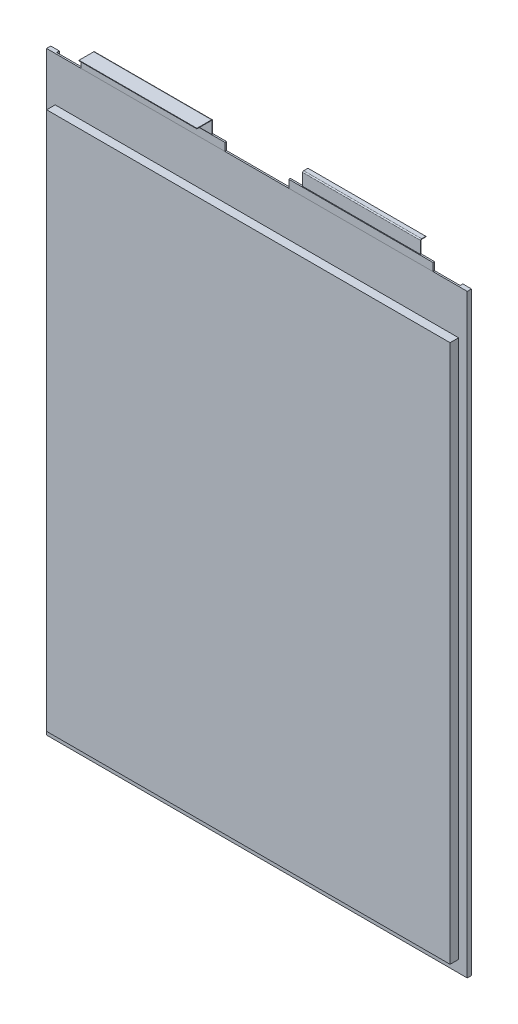
from build123d import *

# Parameters (mm, degrees)
INSULATION_DEPTH      = 0.3
INSULATION_DEPTH_BACK = 0.3
SKETCH1_W             = 160.6
SKETCH1_H             = 227
MAIN_BODY_DEPTH       = 3.55
MAIN_BODY_DEPTH_BACK  = 3.55
SKETCH2_W             = 154
SKETCH2_H             = 205.5
SIDE_FOLDS_DEPTH      = 1.016
SKETCH114_W           = 55
SKETCH114_H           = 0.6
BOSS_EXTRUDE1_DEPTH   = 3
BOSS_EXTRUDE1_2_DEPTH = 3
BASE_FLANGE1_DEPTH    = 45
BASE_FLANGE2_DEPTH    = 45


# Sheet-metal steps are written as plain solids
with BuildPart() as part:
    # Sketch1 → Insulation (new, two sides: drawn at the far end of the back side and taken through both)
    with BuildSketch(Plane.XY.offset(-INSULATION_DEPTH_BACK)):
        Rectangle(SKETCH1_W, SKETCH1_H)
    extrude(amount=INSULATION_DEPTH + INSULATION_DEPTH_BACK)

    # Sketch2 → Main Body (add, two sides: drawn at the far end of the back side and taken through both)
    with BuildSketch(Plane.XY.offset(-MAIN_BODY_DEPTH_BACK)):
        with Locations((0, -6.25)):
            Rectangle(SKETCH2_W, SKETCH2_H)
    extrude(amount=MAIN_BODY_DEPTH + MAIN_BODY_DEPTH_BACK)

    # Sketch5 → Side Folds (add)
    with BuildSketch(Plane(origin=(0, 0, -0.3), x_dir=(-1, 0, 0), z_dir=(0, 0, -1))):
        Polygon((-77, -109), (-77, 96.5), (-77, 113.5), (-80.3, 113.5), (-80.3, -113.5), (-77, -113.5), align=None)
        Polygon((77, 113.5), (77, 96.5), (77, -109), (77, -113.5), (80.3, -113.5), (80.3, 113.5), align=None)
    extrude(amount=SIDE_FOLDS_DEPTH)


with BuildPart() as body_2:
    # Sketch114 → Boss-Extrude1 (new body)
    with BuildSketch(Plane(origin=(0, 113.5, 0), x_dir=(1, 0, 0), z_dir=(0, 1, 0))):
        with Locations((-39.7, 0)):
            Rectangle(SKETCH114_W, SKETCH114_H)
    extrude(amount=BOSS_EXTRUDE1_DEPTH)


with BuildPart() as body_3:
    # Sketch114 → Boss-Extrude1 2 (new body)
    with BuildSketch(Plane(origin=(0, 113.5, 0), x_dir=(1, 0, 0), z_dir=(0, 1, 0))):
        with Locations((39.7, 0)):
            Rectangle(SKETCH114_W, SKETCH114_H)
    extrude(amount=BOSS_EXTRUDE1_2_DEPTH)


with BuildPart() as body_4:
    # Sketch115 → Base-Flange1 (new body)
    with BuildSketch(Plane.ZY.offset(62.2)):
        with BuildLine():
            Line((0, 116.5), (0, 121.1))
            ThreePointArc((0, 121.1), (0.117157288, 121.382842712), (0.4, 121.5))
            Line((0.4, 121.5), (6, 121.5))
            Line((6, 121.5), (6, 121.3))
            Line((6, 121.3), (0.4, 121.3))
            ThreePointArc((0.4, 121.3), (0.258578644, 121.241421356), (0.2, 121.1))
            Line((0.2, 121.1), (0.2, 116.5))
            Line((0.2, 116.5), (0, 116.5))
        make_face()
    extrude(amount=-BASE_FLANGE1_DEPTH)


with BuildPart() as body_5:
    # Sketch120 → Base-Flange2 (new body)
    with BuildSketch(Plane(origin=(62.2, 0, 0), x_dir=(0, 0, -1), z_dir=(1, 0, 0))):
        with BuildLine():
            Line((0, 116.5), (0, 121.1))
            ThreePointArc((0, 121.1), (0.117157288, 121.382842712), (0.4, 121.5))
            Line((0.4, 121.5), (2, 121.5))
            Line((2, 121.5), (2, 121.3))
            Line((2, 121.3), (0.4, 121.3))
            ThreePointArc((0.4, 121.3), (0.258578644, 121.241421356), (0.2, 121.1))
            Line((0.2, 121.1), (0.2, 116.5))
            Line((0.2, 116.5), (0, 116.5))
        make_face()
    extrude(amount=-BASE_FLANGE2_DEPTH)


solid = Compound([part.part, body_2.part, body_3.part, body_4.part, body_5.part])
